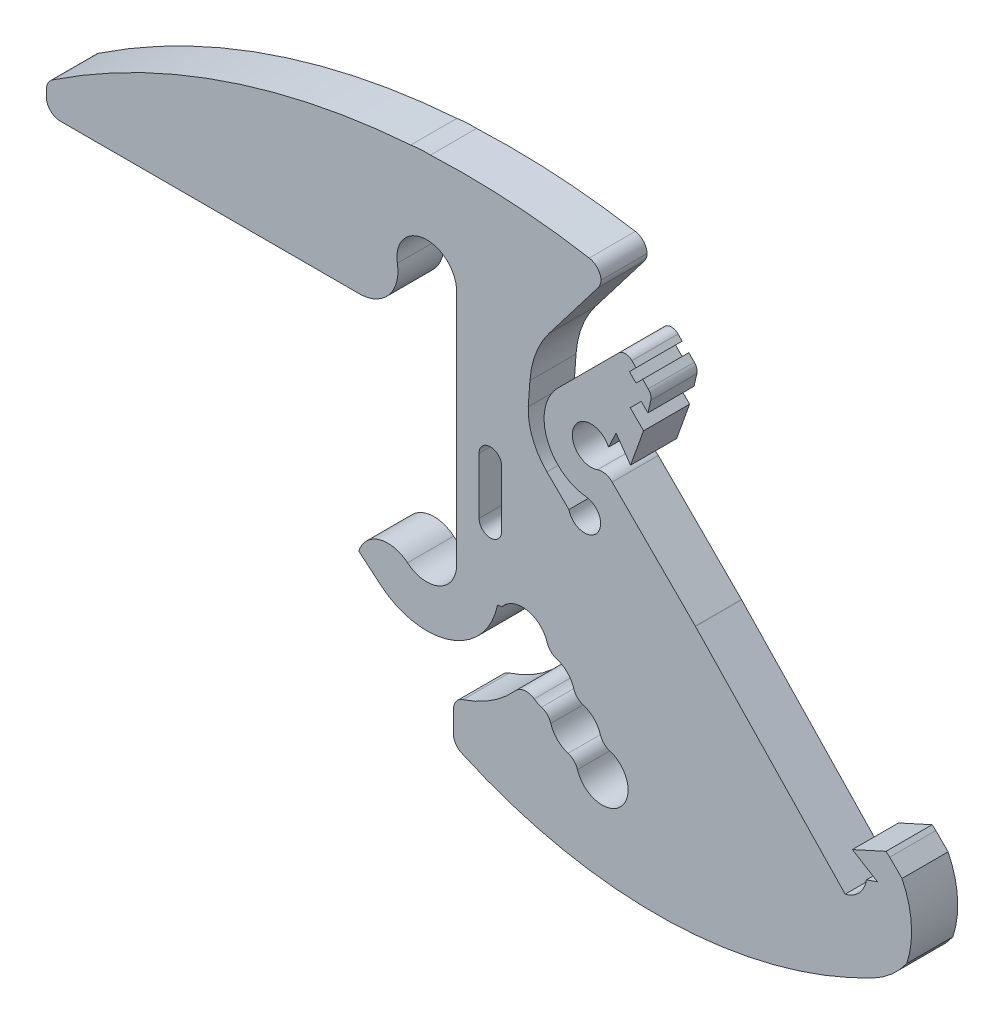
from build123d import *

# Parameters (mm, degrees)
CART_CLIP_DEPTH                    = 4.9022
DEVICE_CLIP_DEPTH                  = 4.9022
JOINT_DEPTH                        = 4.9022
JOINT_FILLETS_R                    = 1
DEVICE_CLIP_FLEX_RELIEF_GEOMETRY_R = 2
DEVICE_CLIP_FLEX_RELIEF_DEPTH      = 62.785838519
SNAP_IN_RELIEF_DEPTH               = 6.35
BOTTOM_BEEFUP_DEPTH                = 4.9022
CABLE_HOLE_R                       = 2.75
CABLE_HOLE_CUT_DEPTH               = 6.35
SHELF_TAIL_DEPTH                   = 4.9022
FRONT_TAB_BEEF_DEPTH               = 4.9022
TOP_CURVE_EXTRUSION_DEPTH          = 4.9022
LPATTERN1_COUNT                    = 4
LPATTERN1_PITCH                    = 4
POSCON_BOTTOM_SNAPBEEF_DEPTH       = 4.9022
POSCON_TOP_CLIP_FLEX_RELIEF_DEPTH  = 6.35
ZIP_TIE_SLOT_DEPTH                 = 6.35
POSCON_BOTTOM_SNAP_RELIEF_DEPTH    = 6.35
SMALL_FILLET_R                     = 1.5
POSCON_TOP_SNAP_RELIEF_DEPTH       = 6.35
LARGE_FILLET_R                     = 10


with BuildPart() as part:
    # Cart Clip Geometry → Cart Clip (new body)
    with BuildSketch(Plane.XY):
        with BuildLine():
            Line((11.175, 4.575), (7.675, -8.575))
            Line((7.675, -8.575), (7.675, -12.575))
            ThreePointArc((7.675, -12.575), (3.243595159, -19.530912266), (-4.933394904, -18.454391101))
            Line((-4.933394904, -18.454391101), (-7.231528234, -16.526028272))
            ThreePointArc((-7.231528234, -16.526028272), (-5.042617938, -14.377626523), (-2.040850661, -15.007191107))
            ThreePointArc((-2.040850661, -15.007191107), (1.341812981, -15.452527224), (3.175, -12.575))
            Line((3.175, -12.575), (3.175, 12.575))
            ThreePointArc((3.175, 12.575), (-0.276719483, 15.737918166), (-3.126764616, 12.023667036))
            ThreePointArc((-3.126764616, 12.023667036), (-5.791346514, 7.43274359), (-10.766819067, 9.282405083))
            Line((-10.766819067, 9.282405083), (-11.00522664, 10.634481615))
            ThreePointArc((-11.00522664, 10.634481615), (-0.973965425, 23.707475751), (11.175, 12.575))
            Line((11.175, 12.575), (11.175, 4.575))
        make_face()
    extrude(amount=-CART_CLIP_DEPTH)



with BuildPart() as body_2:
    # Device Clip Geometry → Device Clip (new body)
    with BuildSketch(Plane.XY):
        with BuildLine():
            Line((22.245178849, 15.087875605), (21.538072068, 14.380768824))
            Line((21.538072068, 14.380768824), (22.243106562, 13.67573433))
            Line((22.243106562, 13.67573433), (22.950213344, 14.382841111))
            Line((22.950213344, 14.382841111), (23.537178094, 13.79587636))
            ThreePointArc((23.537178094, 13.79587636), (23.791320059, 13.364452092), (23.804462509, 12.863910072))
            Line((23.804462509, 12.863910072), (23.504826292, 11.565486463))
            Line((23.504826292, 11.565486463), (22.79771951, 12.272593245))
            Line((22.79771951, 12.272593245), (21.623922254, 11.098795988))
            Line((21.623922254, 11.098795988), (23.038135816, 9.684582425))
            Line((23.038135816, 9.684582425), (21.659277593, 5.830850468))
            Line((21.659277593, 5.830850468), (20.24506403, 7.24506403))
            Line((20.24506403, 7.24506403), (18, 5))
            Line((18, 5), (44.516504294, -21.516504294))
            Line((44.516504294, -21.516504294), (46.761568325, -19.271440264))
            Line((46.761568325, -19.271440264), (45.347354762, -17.857226702))
            Line((45.347354762, -17.857226702), (49.20108672, -16.478368479))
            Line((49.20108672, -16.478368479), (50.615300282, -17.892582041))
            Line((50.615300282, -17.892582041), (51.789097539, -16.718784784))
            Line((51.789097539, -16.718784784), (51.081990758, -16.011678003))
            Line((51.081990758, -16.011678003), (52.380414367, -15.712041786))
            ThreePointArc((52.380414367, -15.712041786), (52.880956387, -15.725184235), (53.312380655, -15.9793262))
            Line((53.312380655, -15.9793262), (53.899345406, -16.566290951))
            Line((53.899345406, -16.566290951), (53.192238624, -17.273397732))
            Line((53.192238624, -17.273397732), (53.897273119, -17.978432226))
            Line((53.897273119, -17.978432226), (54.6043799, -17.271325445))
            Line((54.6043799, -17.271325445), (55.041788732, -17.708734278))
            ThreePointArc((55.041788732, -17.708734278), (55.334681951, -18.415841059), (55.041788732, -19.12294784))
            Line((55.041788732, -19.12294784), (48.582368286, -25.582368286))
            ThreePointArc((48.582368286, -25.582368286), (45.04683438, -27.04683438), (41.511300474, -25.582368286))
            Line((41.511300474, -25.582368286), (13.934136008, 1.99479618))
            ThreePointArc((13.934136008, 1.99479618), (12.469669914, 5.530330086), (13.934136008, 9.065863992))
            Line((13.934136008, 9.065863992), (20.393556454, 15.525284438))
            ThreePointArc((20.393556454, 15.525284438), (21.100663236, 15.818177657), (21.807770017, 15.525284438))
            Line((21.807770017, 15.525284438), (22.245178849, 15.087875605))
        make_face()
    extrude(amount=-DEVICE_CLIP_DEPTH)


with BuildPart() as part_1:
    add(part.part)

    add(body_2.part)  # Joint merges body 2
    # Joint Geometry → Joint (add)
    with BuildSketch(Plane.XY):
        Polygon((7.675, -8.575), (41.511300474, -25.582368286), (13.934136008, 1.99479618), (11.175, 4.575), align=None)
    extrude(amount=-JOINT_DEPTH)

    # joint fillets
    # the kernel refuses this fillet: 1 mm, written as the material it adds along each edge
    with BuildSketch(Plane(origin=(7.675, -8.575, 0), x_dir=(0.8934828469815188, -0.4490973192413867, 0), z_dir=(0, 0, -1))) as joint_fillets_piece_1:
        with BuildLine():
            CenterArc((JOINT_FILLETS_R * 1.62185242183, JOINT_FILLETS_R), JOINT_FILLETS_R, 153.314216372, 116.685783628)
            Line((JOINT_FILLETS_R * 0.728369574849, JOINT_FILLETS_R * 1.44909731924), (0, 0))
            Line((0, 0), (JOINT_FILLETS_R * 1.62185242183, 0))
        make_face()
    extrude(amount=4.9022)
    with BuildSketch(Plane(origin=(41.511300474, -25.582368286, 0), x_dir=(-0.8934828469815294, 0.44909731924136564, 0), z_dir=(0, 0, -1))) as joint_fillets_piece_2:
        with BuildLine():
            CenterArc((0.153680417, -1), JOINT_FILLETS_R, 90, 16.706554242)
            ThreePointArc((-0.133789669, -0.042210383), (-0.066746785, -0.02157445), (0, 0))
            Line((0, 0), (0.153680417, 0))
        make_face()
    extrude(amount=4.9022)
    with BuildSketch(Plane(origin=(13.934136008, 1.99479618, 0), x_dir=(-0.7303933527208794, 0.6830267566509771, 0), z_dir=(0, 0, -1))) as joint_fillets_piece_3:
        with BuildLine():
            CenterArc((4.307177284, 1), JOINT_FILLETS_R, 138.225615508, 131.774384492)
            ThreePointArc((3.561403369, 1.66619912), (1.95135729, 0.468333164), (0, 0))
            Line((0, 0), (4.307177284, 0))
        make_face()
    extrude(amount=4.9022)
    with BuildSketch(Plane(origin=(11.175, 4.575, 0), x_dir=(0, 1, 0), z_dir=(0, 0, -1))) as joint_fillets_piece_4:
        with BuildLine():
            CenterArc((JOINT_FILLETS_R * 0.43397607901, JOINT_FILLETS_R), JOINT_FILLETS_R, 223.080619659, 46.919380341)
            Line((-JOINT_FILLETS_R * 0.296417273711, JOINT_FILLETS_R * 0.316973243349), (0, 0))
            Line((0, 0), (JOINT_FILLETS_R * 0.43397607901, 0))
        make_face()
    extrude(amount=4.9022)

    # Device Clip Flex Relief Geometry → Device Clip Flex Relief (cut, through all)
    with BuildSketch(Plane.XY):
        with Locations((17.469669914, 5.530330086)):
            Circle(DEVICE_CLIP_FLEX_RELIEF_GEOMETRY_R)
    extrude(amount=-DEVICE_CLIP_FLEX_RELIEF_DEPTH, mode=Mode.SUBTRACT)

    # Sketch5 → SNAP IN RELIEF (cut)
    with BuildSketch(Plane.XY):
        with BuildLine():
            Line((44.470063399, -22.25362726), (28.550321446, -5.550321446))
            Line((28.550321446, -5.550321446), (46.761568325, -19.271440264))
            ThreePointArc((46.761568325, -19.271440264), (46.141143244, -21.16619399), (44.470063399, -22.25362726))
        make_face()
    extrude(amount=-SNAP_IN_RELIEF_DEPTH, mode=Mode.SUBTRACT)

    # BOTTOM BEEFUP SKETCH → BOTTOM BEEFUP (add)
    with BuildSketch(Plane.XY):
        with BuildLine():
            Line((10.677043667, -13.889484035), (7.526361766, -14.078164518))
            Line((7.526361766, -14.078164518), (7.208614318, -8.772257329))
            Line((7.208614318, -8.772257329), (10.675, -9.282514389))
            Line((10.675, -9.282514389), (44.278748713, -25.488746112))
            Line((44.278748713, -25.488746112), (53.899345406, -16.566290951))
            Line((53.899345406, -16.566290951), (55.041788732, -17.708734278))
            ThreePointArc((55.041788732, -17.708734278), (55.966427661, -19.737585883), (55.333281386, -21.875416975))
            Line((55.333281386, -21.875416975), (50.398436239, -26.810262122))
            ThreePointArc((50.398436239, -26.810262122), (26.922067406, -34.071170743), (2.828292768, -29.238913377))
            Line((2.828292768, -29.238913377), (2.828292768, -24.930419257))
            ThreePointArc((2.828292768, -24.930419257), (8.371790669, -22.091761318), (11.894021473, -16.955397036))
            Line((11.894021473, -16.955397036), (10.677043667, -13.889484035))
        make_face()
    extrude(amount=-BOTTOM_BEEFUP_DEPTH)

    # CABLE HOLE → CABLE HOLE CUT (cut)
    with BuildSketch(Plane.XY):
        with Locations((10.162604388, -15.724968902)):
            Circle(CABLE_HOLE_R)
    cable_hole_cut = extrude(amount=-CABLE_HOLE_CUT_DEPTH, mode=Mode.SUBTRACT)

    # BOX SLIDE BEEF → SHELF TAIL (add)
    with BuildSketch(Plane.XY):
        Polygon((-7.182015159, 7.190807632), (-40.440555285, 7.190807632), (-40.440555285, 10.131018627), (-4.155347731, 22.948702822), align=None)
    extrude(amount=-SHELF_TAIL_DEPTH)

    # BEHIND TOP CLIP BEEF SKETCH → FRONT TAB BEEF (add)
    with BuildSketch(Plane.XY):
        Polygon((18.518382836, 20.841188896), (11.175, 11.254753066), (0.590090247, 23.734409415), (18.518382836, 22.48088631), align=None)
    extrude(amount=-FRONT_TAB_BEEF_DEPTH)

    # TOP CURVE → TOP CURVE EXTRUSION (add)
    with BuildSketch(Plane.XY):
        with BuildLine():
            Line((-40.440555285, 10.131018627), (-38.751141722, 8.751938886))
            Line((-38.751141722, 8.751938886), (0, 16.86846238))
            Line((0, 16.86846238), (13.175622622, 16.86846238))
            Line((13.175622622, 16.86846238), (18.518382836, 22.48088631))
            ThreePointArc((18.518382836, 22.48088631), (-12.184902527, 22.148517873), (-40.440555285, 10.131018627))
        make_face()
    extrude(amount=-TOP_CURVE_EXTRUSION_DEPTH)

    # LPattern1: CABLE HOLE CUT ×4
    with Locations(*[Vector(0.7071067811865482, -0.7071067811865469, 0) * (i * LPATTERN1_PITCH) for i in range(1, LPATTERN1_COUNT)]):
        add(cable_hole_cut, mode=Mode.SUBTRACT)

    # Sketch13 → POSCON BOTTOM SNAPBEEF (add)
    with BuildSketch(Plane.XY):
        Polygon((49.20108672, -16.478368479), (48.811303545, -16.138109098), (45.23751859, -17.761345734), (45.347354762, -17.857226702), align=None)
    extrude(amount=-POSCON_BOTTOM_SNAPBEEF_DEPTH)

    # Sketch14 → POSCON TOP CLIP FLEX RELIEF (cut)
    with BuildSketch(Plane.XY):
        with BuildLine():
            Line((12.771743003, 0.768531527), (15.105169217, -1.533595637))
            ThreePointArc((15.105169217, -1.533595637), (18.050301611, -2.270498232), (16.94674386, 0.557750439))
            ThreePointArc((16.94674386, 0.557750439), (15.316695608, 1.017603456), (13.933681531, 1.995250716))
            ThreePointArc((13.933681531, 1.995250716), (12.82864211, 3.669991158), (12.470969242, 5.644310734))
            Line((12.470969242, 5.644310734), (11.175, 11.254753066))
            Line((11.175, 11.254753066), (10.784695152, 5.767722626))
            ThreePointArc((10.784695152, 5.767722626), (11.253514306, 3.059570639), (12.771743003, 0.768531527))
        make_face()
    extrude(amount=-POSCON_TOP_CLIP_FLEX_RELIEF_DEPTH, mode=Mode.SUBTRACT)

    # Sketch15 → ZIP TIE SLOT (cut)
    with BuildSketch(Plane.XY):
        with BuildLine():
            Line((7.959147306, -1.122008403), (7.959147306, -7.122008403))
            ThreePointArc((7.959147306, -7.122008403), (6.759147306, -8.322008403), (5.559147306, -7.122008403))
            Line((5.559147306, -7.122008403), (5.559147306, -1.122008403))
            ThreePointArc((5.559147306, -1.122008403), (6.759147306, 0.077991597), (7.959147306, -1.122008403))
        make_face()
    extrude(amount=-ZIP_TIE_SLOT_DEPTH, mode=Mode.SUBTRACT)

    # Sketch16 → POSCON BOTTOM SNAP RELIEF (cut)
    with BuildSketch(Plane.XY):
        Polygon((45.23751859, -17.761345734), (47.901521822, -19.397502687), (45.962169994, -20.070838595), align=None)
        Polygon((41.374346961, -4.041292507), (53.040140925, -21.594507061), (50.398436239, -26.810262122), (52.008012569, -28.207638953), (59.817475223, -20.235408925), align=None)
    extrude(amount=-POSCON_BOTTOM_SNAP_RELIEF_DEPTH, mode=Mode.SUBTRACT)

    # SMALL FILLET
    # the kernel refuses this fillet: 1.5 mm, written as the material it takes off along each edge
    with BuildSketch(Plane(origin=(18.518382836, 20.841188896, 1.271229884), x_dir=(0, 1, 0), z_dir=(0, 0, -1))) as small_fillet_piece_1:
        with BuildLine():
            CenterArc((SMALL_FILLET_R * 0.338994635756, -SMALL_FILLET_R), SMALL_FILLET_R, 90, 37.452766395)
            Line((-SMALL_FILLET_R * 0.269112560318, -SMALL_FILLET_R * 0.206145077434), (0, 0))
            Line((0, 0), (SMALL_FILLET_R * 0.338994635756, 0))
        make_face()
    extrude(amount=7.444659768, mode=Mode.SUBTRACT)
    with BuildSketch(Plane(origin=(-40.440555285, 7.190807632, 3.75), x_dir=(1, 0, 0), z_dir=(0, 0, -1))) as small_fillet_piece_2:
        with BuildLine():
            CenterArc((SMALL_FILLET_R, -SMALL_FILLET_R), SMALL_FILLET_R, 90, 90)
            Line((0, -SMALL_FILLET_R), (0, 0))
            Line((0, 0), (SMALL_FILLET_R, 0))
        make_face()
    extrude(amount=12.4022, mode=Mode.SUBTRACT)
    with BuildSketch(Plane(origin=(12.911452732, -15.804547683, -7.122565694), x_dir=(0.9911354093588505, -0.13285556185220002, 0), z_dir=(0, 0, 1)), Plane(origin=(13.070610293, -21.30224437, -7.122565694), x_dir=(-0.9911354093588505, 0.1328555618522003, 0), z_dir=(0, 0, 1)), Plane(origin=(15.739879856, -18.632974807, -7.122565694), x_dir=(0.9911354093588505, -0.13285556185220002, 0), z_dir=(0, 0, 1)), Plane(origin=(15.899037418, -24.130671495, -7.122565694), x_dir=(-0.9911354093588505, 0.13285556185220002, 0), z_dir=(0, 0, 1)), Plane(origin=(18.568306981, -21.461401932, -7.122565694), x_dir=(0.9911354093588505, -0.1328555618522003, 0), z_dir=(0, 0, 1))) as small_fillet_piece_3:
        with BuildLine():
            CenterArc((1.130367989, 1.480313697), SMALL_FILLET_R, 204.56214871, 56.144973872)
            ThreePointArc((-0.233898388, 0.856793648), (-0.082131714, 0.437901741), (0, 0))
            ThreePointArc((0, 0), (0.444073139, 0.036091555), (0.888146277, 0))
        make_face()
    extrude(amount=9.342931387, mode=Mode.SUBTRACT)
    with BuildSketch(Plane(origin=(28.550321446, -5.550321446, 0.045028607), x_dir=(-0.707106781186794, 0.7071067811863009, 0), z_dir=(0, 0, -1))) as small_fillet_piece_4:
        with BuildLine():
            CenterArc((SMALL_FILLET_R * 0.012007628629, -SMALL_FILLET_R), SMALL_FILLET_R, 90, 1.37590676)
            Line((-SMALL_FILLET_R * 0.0120041665325, -SMALL_FILLET_R * 0.00028832471901), (0, 0))
            Line((0, 0), (SMALL_FILLET_R * 0.0120076286286, 0))
        make_face()
    extrude(amount=4.992257215, mode=Mode.SUBTRACT)
    with BuildSketch(Plane(origin=(18.883883476, 4.116116524, -7.80789415), x_dir=(-0.845154254728517, -0.5345224838248481, 0), z_dir=(0, 0, 1))) as small_fillet_piece_5:
        with BuildLine():
            CenterArc((1.208074074, 1.463368167), SMALL_FILLET_R, 192.688466763, 64.623066475)
            Line((-0.255294092, 1.133893419), (0, 0))
            ThreePointArc((0, 0), (0.439299663, 0.048842445), (0.878599327, 0))
        make_face()
    extrude(amount=10.713588301, mode=Mode.SUBTRACT)
    with BuildSketch(Plane(origin=(18.518382836, 22.48088631, 3.169498478), x_dir=(-0.9844109148420621, 0.17588391268053638, 0), z_dir=(0, 0, -1))) as small_fillet_piece_6:
        with BuildLine():
            CenterArc((1.255758761, -1.499951674), SMALL_FILLET_R, 89.540076871, 80.329822671)
            Line((-0.220857611, -1.236125805), (0, 0))
            ThreePointArc((0, 0), (0.633899696, 0.002544225), (1.267799391, 0))
        make_face()
    extrude(amount=11.241196956, mode=Mode.SUBTRACT)
    with BuildSketch(Plane(origin=(-40.440555285, 10.131018627, 2.0148186), x_dir=(0, -1, 0), z_dir=(0, 0, -1))) as small_fillet_piece_7:
        with BuildLine():
            CenterArc((0.798236635, -1.5), SMALL_FILLET_R, 90, 56.333812142)
            ThreePointArc((-0.450185479, -0.668469949), (-0.225945502, -0.333660676), (0, 0))
            Line((0, 0), (0.798236635, 0))
        make_face()
    extrude(amount=8.931837199, mode=Mode.SUBTRACT)
    with BuildSketch(Plane(origin=(2.828292768, -29.238913377, 2.423362243), x_dir=(0.9059578964296378, -0.4233677950633301, 0), z_dir=(0, 0, -1))) as small_fillet_piece_8:
        with BuildLine():
            CenterArc((0.954766556, -1.499929156), SMALL_FILLET_R, 89.443139617, 65.509466567)
            Line((-0.404170289, -0.864877463), (0, 0))
            ThreePointArc((0, 0), (0.484672449, 0.002355296), (0.969344897, 0))
        make_face()
    extrude(amount=9.748924486, mode=Mode.SUBTRACT)
    with BuildSketch(Plane(origin=(2.828292768, -24.930419257, 2.856498412), x_dir=(0, -1, 0), z_dir=(0, 0, -1))) as small_fillet_piece_9:
        with BuildLine():
            CenterArc((1.142599365, -1.5), SMALL_FILLET_R, 90, 72.220962593)
            ThreePointArc((-0.285762394, -1.041979601), (-0.131773474, -0.524036088), (0, 0))
            Line((0, 0), (1.142599365, 0))
        make_face()
    extrude(amount=10.615196824, mode=Mode.SUBTRACT)
    with BuildSketch(Plane(origin=(10.488001498, -19.692404694, -9.162708984), x_dir=(-0.6158879347432374, -0.7878337717042281, 0), z_dir=(0, 0, 1))) as small_fillet_piece_10:
        with BuildLine():
            CenterArc((1.805044043, 1.496606563), SMALL_FILLET_R, 183.050070351, 83.095200937)
            ThreePointArc((0.307168917, 1.416793616), (0.248625806, 0.687791303), (0, 0))
            ThreePointArc((0, 0), (0.852101797, 0.028674544), (1.704203594, 0))
        make_face()
    extrude(amount=13.423217968, mode=Mode.SUBTRACT)

    # Sketch12 → POSCON TOP SNAP RELIEF (cut)
    with BuildSketch(Plane.XY):
        Polygon((21.659277593, 5.830850468), (20.119072518, 8.015253176), (19.31101106, 6.31101106), align=None)
    extrude(amount=-POSCON_TOP_SNAP_RELIEF_DEPTH, mode=Mode.SUBTRACT)

    # LARGE FILLET
    # the kernel refuses this fillet: 10 mm, written as the material it adds along each edge
    with BuildSketch(Plane(origin=(11.175, 11.254753066, 0), x_dir=(0.6081071960741756, 0.7938549225663365, 0), z_dir=(0, 0, -1))) as large_fillet_piece_1:
        with BuildLine():
            CenterArc((LARGE_FILLET_R * 0.299862584786, LARGE_FILLET_R), LARGE_FILLET_R, 236.615958522, 33.384041478)
            Line((-LARGE_FILLET_R * 0.250385604815, LARGE_FILLET_R * 0.164998844408), (0, 0))
            Line((0, 0), (LARGE_FILLET_R * 0.299862584786, 0))
        make_face()
    extrude(amount=4.9022)
    # the kernel refuses this fillet: 10 mm, written as the material it takes off along each edge
    with BuildSketch(Plane(origin=(50.398436239, -26.810262122, 8.419191937), x_dir=(0.4518362349303937, 0.8921009005734306, 0), z_dir=(0, 0, -1))) as large_fillet_2_piece_1:
        with BuildLine():
            CenterArc((3.011153161, -10), LARGE_FILLET_R, 90, 35.558833916)
            ThreePointArc((-2.804233042, -1.86481203), (-1.417862433, -0.908727914), (0, 0))
            Line((0, 0), (3.011153161, 0))
        make_face()
    extrude(amount=21.740583873, mode=Mode.SUBTRACT)
    with BuildSketch(Plane(origin=(53.040140925, -21.594507061, 14.324954892), x_dir=(-0.5535056363381489, 0.8328454301621045, 0), z_dir=(0, 0, -1))) as large_fillet_2_piece_2:
        with BuildLine():
            CenterArc((5.87668539, -9.914497569), LARGE_FILLET_R, 97.497850744, 52.97155359)
            Line((-2.824240811, -4.985615014), (0, 0))
            Line((0, 0), (4.571795375, 0))
        make_face()
    extrude(amount=33.552109783, mode=Mode.SUBTRACT)


solid = part_1.part
